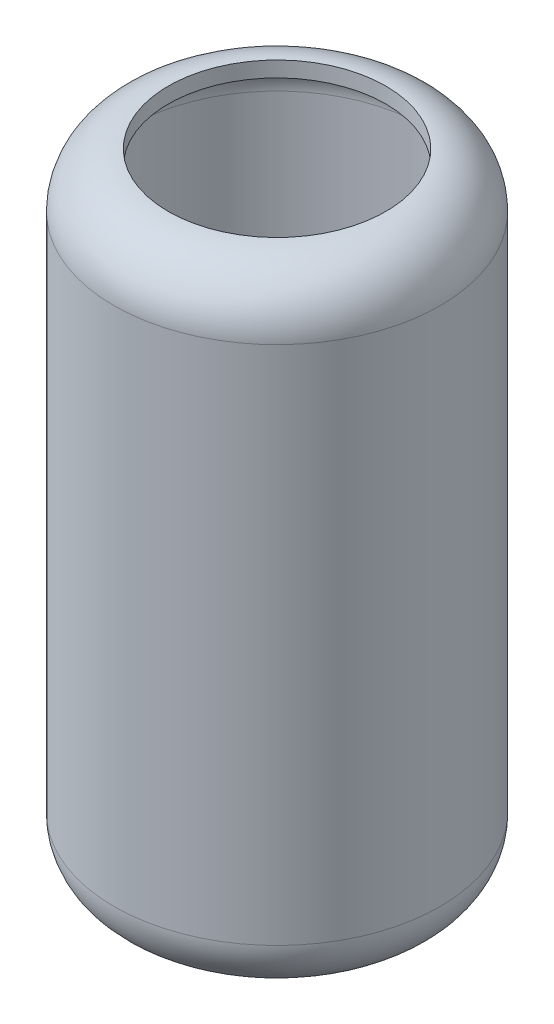
from build123d import *

# Parameters (mm, degrees)
SKETCH1_R           = 10.5
BOSS_EXTRUDE1_DEPTH = 40.5
FILLET1_R           = 3.5


# Read off the part's stored shape, not the designer's step: Shell4
with BuildPart() as part:
    # Sketch1 → Boss-Extrude1 (new body)
    with BuildSketch(Plane(origin=(0, 0, 0), x_dir=(1, 0, 0), z_dir=(0, 1, 0))):
        with Locations(Location((0, 0, 0), (0, 0, 270))):
            Circle(SKETCH1_R)
    extrude(amount=BOSS_EXTRUDE1_DEPTH)

    # Fillet1
    fillet1_edges = [part.edges().sort_by_distance(p)[0] for p in [
        (0, 0, -10.5),
        (0, 40.5, -10.5),
    ]]
    fillet(fillet1_edges, radius=FILLET1_R)

    # Shell4 outline → Shell4 (revolve, cut)
    with BuildSketch(Plane.XY):
        with BuildLine():
            Line((0, 1), (7, 1))
            ThreePointArc((7, 1), (8.767766953, 1.732233047), (9.5, 3.5))
            Line((9.5, 3.5), (9.5, 37))
            ThreePointArc((9.5, 37), (8.767766953, 38.767766953), (7, 39.5))
            Line((7, 39.5), (7, 40.5))
            Line((7, 40.5), (0, 40.5))
            Line((0, 40.5), (0, 1))
        make_face()
    revolve(axis=Axis((0, 0, 0), (0, 1, 0)), mode=Mode.SUBTRACT)


solid = part.part
